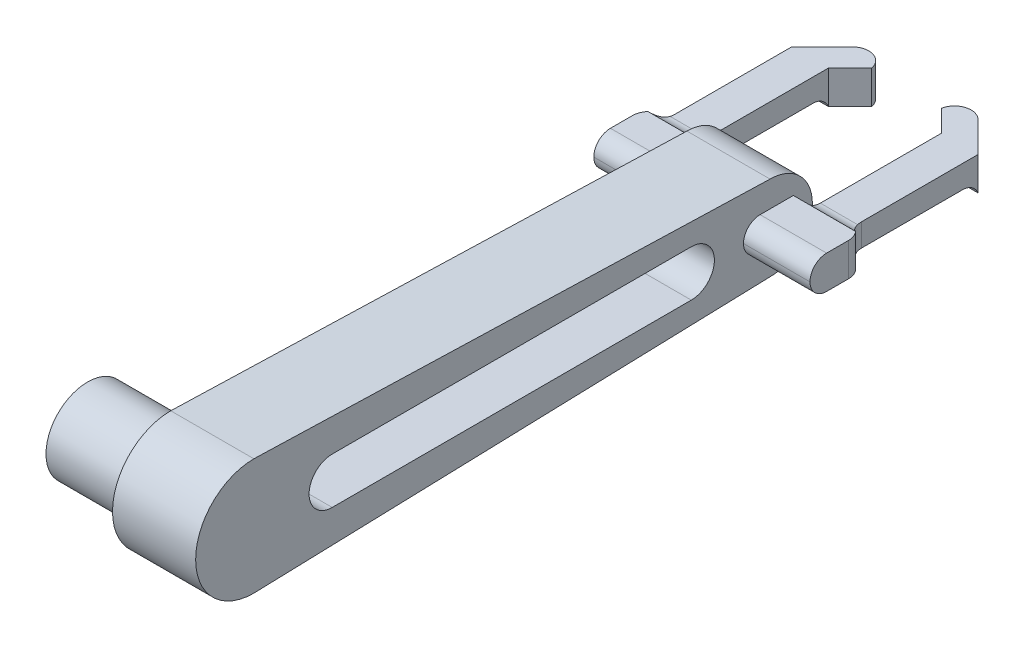
from build123d import *

# Parameters (mm, degrees)
Y_KSEKLIK_EKSTR_ZYON1_DEPTH = 50
IZIM2_R                     = 25
Y_KSEKLIK_EKSTR_ZYON2_DEPTH = 50
IZIM3_W                     = 30
IZIM3_H                     = 20
Y_KSEKLIK_EKSTR_ZYON3_DEPTH = 40
IZIM4_W                     = 22.094425692
IZIM4_H                     = 13.717833442
Y_KSEKLIK_EKSTR_ZYON4_DEPTH = 80
Y_KSEKLIK_EKSTR_ZYON5_DEPTH = 20
RADYUS1_R                   = 10
RADYUS3_R                   = 10
RADYUS4_R                   = 10
RADYUS8_R                   = 10
RADYUS9_R                   = 10
RADYUS1_OF_AYNALAMA2_R      = 10
RADYUS3_OF_AYNALAMA2_R      = 10
RADYUS4_OF_AYNALAMA2_R      = 10
RADYUS8_OF_AYNALAMA2_R      = 10
RADYUS10_R                  = 10
KES_EKSTR_ZYON1_DEPTH       = 60


# Some blends are built 0.0001 mm under size
with BuildPart() as part:
    # Çizim1 → Yükseklik-Ekstrüzyon1 (new body)
    with BuildSketch(Plane(origin=(0, 0, 0), x_dir=(0, 0, -1), z_dir=(1, 0, 0))):
        with BuildLine():
            Line((0, 35), (310.428755788, 25.455915403))
            ThreePointArc((310.428755788, 25.455915403), (335.884671191, 0), (310.428755788, -25.455915403))
            Line((310.428755788, -25.455915403), (0, -35))
            ThreePointArc((0, -35), (-35, 0), (0, 35))
        make_face()
    extrude(amount=Y_KSEKLIK_EKSTR_ZYON1_DEPTH)

    # Çizim2 → Yükseklik-Ekstrüzyon2 (add)
    with BuildSketch(Plane.ZY):
        with Locations(Location((0, 0, 0), (0, 0, 180))):
            Circle(IZIM2_R)
    extrude(amount=Y_KSEKLIK_EKSTR_ZYON2_DEPTH)

    # Çizim3 → Yükseklik-Ekstrüzyon3 (add)
    with BuildSketch(Plane(origin=(50, 0, 0), x_dir=(0, 0, -1), z_dir=(1, 0, 0))):
        with Locations((309.433006003, -0.091766489)):
            Rectangle(IZIM3_W, IZIM3_H)
    y_kseklik_ekstr_zyon3 = extrude(amount=Y_KSEKLIK_EKSTR_ZYON3_DEPTH)

    # Çizim4 → Yükseklik-Ekstrüzyon4 (add)
    with BuildSketch(Plane(origin=(0, 0, -324.433006003), x_dir=(-1, 0, 0), z_dir=(0, 0, -1))):
        with Locations((-70, -0.091766489)):
            Rectangle(IZIM4_W, IZIM4_H)
    y_kseklik_ekstr_zyon4 = extrude(amount=Y_KSEKLIK_EKSTR_ZYON4_DEPTH)

    # Çizim5 → Yükseklik-Ekstrüzyon5 (add)
    with BuildSketch(Plane(origin=(0, 6.767150232, 0), x_dir=(1, 0, 0), z_dir=(0, 1, 0))):
        Polygon((81.047212846, 404.433006003), (45.927609997, 439.552608852), (45.927609997, 417.45818316), (58.952787154, 404.433006003), align=None)
    y_kseklik_ekstr_zyon5 = extrude(amount=-Y_KSEKLIK_EKSTR_ZYON5_DEPTH)

    # Radyus1
    # the kernel refuses this fillet: 10 mm, written as the material it adds along each edge
    with BuildSketch(Plane(origin=(81.047212846, 6.767150232, -324.433006003), x_dir=(0, 1, 0), z_dir=(-1, 0, 0)), Plane(origin=(58.952787154, -6.95068321, -324.433006003), x_dir=(0, -1, 0), z_dir=(1, 0, 0))) as radyus1_piece_1:
        with BuildLine():
            CenterArc((10, 7.277036582), RADYUS1_R, 180, 46.694227485)
            Line((0, 7.277036582), (-0.2, 7.277036582))
            Line((-0.2, 7.277036582), (-0.2, 0))
            Line((-0.2, 0), (0, -0.2))
            ThreePointArc((0, -0.2), (1.570541639, -0.2), (3.003904945, -0.145540732))
            Line((3.003904945, -0.145540732), (3.141083279, 0))
        make_face()
    extrude(amount=22.094425692)
    with BuildSketch(Plane(origin=(81.047212846, -6.95068321, -324.433006003), x_dir=(1, 0, 0), z_dir=(0, 1, 0))) as radyus1_piece_2:
        with BuildLine():
            CenterArc((10, 9.945016101), RADYUS1_R, 180, 83.988891185)
            Line((0, 9.945016101), (-0.2, 9.945016101))
            Line((-0.2, 9.945016101), (-0.2, 0))
            Line((-0.2, 0), (0, -0.2))
            ThreePointArc((0, -0.2), (4.476393577, -0.2), (8.931842897, -0.198900322))
            Line((8.931842897, -0.198900322), (8.952787154, 0))
        make_face()
    extrude(amount=13.717833442)
    with BuildSketch(Plane(origin=(81.047212846, -6.95068321, -324.433006003), x_dir=(1, 0, 0), z_dir=(0, 1, 0))) as radyus1_piece_3a_section:
        with BuildLine():
            CenterArc((10, 9.945016101), RADYUS1_R, 180, 83.988891185)
            Line((0, 9.945016101), (-0.2, 9.945016101))
            Line((-0.2, 9.945016101), (-0.2, 0))
            Line((-0.2, 0), (0, -0.2))
            ThreePointArc((0, -0.2), (4.476393577, -0.2), (8.931842897, -0.198900322))
            Line((8.931842897, -0.198900322), (8.952787154, 0))
        make_face()
    radyus1_piece_3a = extrude(amount=38.580373695, mode=Mode.PRIVATE)
    radyus1_piece_3a = split(radyus1_piece_3a, bisect_by=Plane(origin=(83.202696921, 6.767150232, -326.71552739), z_dir=(0, 1, 0)), keep=Keep.TOP, mode=Mode.PRIVATE)
    with BuildSketch(Plane(origin=(99.2398043, 6.767150232, -324.433006003), x_dir=(0, 1, 0), z_dir=(-1, 0, 0))) as radyus1_piece_3b_section:
        with BuildLine():
            CenterArc((10, 7.277036582), RADYUS1_R, 180, 46.694227485)
            Line((0, 7.277036582), (-0.2, 7.277036582))
            Line((-0.2, 7.277036582), (-0.2, 0))
            Line((-0.2, 0), (0, -0.2))
            ThreePointArc((0, -0.2), (1.570541639, -0.2), (3.003904945, -0.145540732))
            Line((3.003904945, -0.145540732), (3.141083279, 0))
        make_face()
    radyus1_piece_3b = extrude(amount=40.287017146, mode=Mode.PRIVATE)
    radyus1_piece_3b = split(radyus1_piece_3b, bisect_by=Plane(origin=(81.047212846, 7.54925635, -326.367172989), z_dir=(1, 0, 0)), keep=Keep.TOP, mode=Mode.PRIVATE)
    radyus1_piece_3 = radyus1_piece_3a & radyus1_piece_3b
    add(radyus1_piece_3)
    with BuildSketch(Plane(origin=(81.047212846, -31.813223463, -324.433006003), x_dir=(1, 0, 0), z_dir=(0, 1, 0))) as radyus1_piece_4a_section:
        with BuildLine():
            CenterArc((10, 9.945016101), RADYUS1_R, 180, 83.988891185)
            Line((0, 9.945016101), (-0.2, 9.945016101))
            Line((-0.2, 9.945016101), (-0.2, 0))
            Line((-0.2, 0), (0, -0.2))
            ThreePointArc((0, -0.2), (4.476393577, -0.2), (8.931842897, -0.198900322))
            Line((8.931842897, -0.198900322), (8.952787154, 0))
        make_face()
    radyus1_piece_4a = extrude(amount=38.580373695, mode=Mode.PRIVATE)
    radyus1_piece_4a = split(radyus1_piece_4a, bisect_by=Plane(origin=(83.202696921, -6.95068321, -326.71552739), z_dir=(0, -1, 0)), keep=Keep.TOP, mode=Mode.PRIVATE)
    with BuildSketch(Plane(origin=(58.952787154, -6.95068321, -324.433006003), x_dir=(0, -1, 0), z_dir=(1, 0, 0))) as radyus1_piece_4b_section:
        with BuildLine():
            CenterArc((10, 7.277036582), RADYUS1_R, 180, 46.694227485)
            Line((0, 7.277036582), (-0.2, 7.277036582))
            Line((-0.2, 7.277036582), (-0.2, 0))
            Line((-0.2, 0), (0, -0.2))
            ThreePointArc((0, -0.2), (1.570541639, -0.2), (3.003904945, -0.145540732))
            Line((3.003904945, -0.145540732), (3.141083279, 0))
        make_face()
    radyus1_piece_4b = extrude(amount=40.287017146, mode=Mode.PRIVATE)
    radyus1_piece_4b = split(radyus1_piece_4b, bisect_by=Plane(origin=(81.047212846, -7.732789327, -326.367172989), z_dir=(1, 0, 0)), keep=Keep.TOP, mode=Mode.PRIVATE)
    radyus1_piece_4 = radyus1_piece_4a & radyus1_piece_4b
    add(radyus1_piece_4)

    # Radyus3
    radyus3_edges = [part.edges().sort_by_distance(p)[0] for p in [
        (90, -0.091766489, -324.433006003),
    ]]
    fillet(radyus3_edges, radius=RADYUS3_R)

    # Radyus4
    radyus4_edges = [part.edges().sort_by_distance(p)[0] for p in [
        (70, -10.091766489, -294.433006003),
        (70, 9.908233511, -294.433006003),
    ]]
    fillet(radyus4_edges, radius=RADYUS4_R - 0.0001)  # a hair under: the kernel refuses the full size

    # Radyus8
    # the kernel refuses this fillet: 10 mm, written as the material it takes off along each edge
    with BuildSketch(Plane(origin=(45.927609997, 66.498077734, -439.552608852), x_dir=(0, 0, 1), z_dir=(0, -1, 0))) as radyus8_piece_1:
        with BuildLine():
            CenterArc((23.965525365, -9.823389741), RADYUS8_R, 100.784173019, 124.215826981)
            Line((16.894457553, -16.894457553), (16.753036197, -17.03587891))
            Line((16.753036197, -17.03587891), (-0.141421356, -0.141421356))
            Line((-0.141421356, -0.141421356), (0, 0.2))
            ThreePointArc((0, 0.2), (11.047212846, 0.2), (22.057003698, 0.196467795))
            Line((22.057003698, 0.196467795), (22.094425692, 0))
        make_face()
    extrude(amount=139.461855004, mode=Mode.SUBTRACT)

    # Radyus9
    # the kernel refuses this fillet: 10 mm, written as the material it adds along each edge
    with BuildSketch(Plane(origin=(58.952787154, -6.95068321, -404.433006003), x_dir=(0, 0, 1), z_dir=(1, 0, 0))) as radyus9_piece_1_section:
        with BuildLine():
            CenterArc((9.283195274, 10), RADYUS9_R, 201.825642852, 68.174357148)
            Line((0, 6.282166558), (-0.185663905, 6.207809889))
            ThreePointArc((-0.185663905, 6.207809889), (-0.2, 3.141083279), (-0.2, 0))
            Line((-0.2, 0), (0, -0.2))
            Line((0, -0.2), (9.283195274, -0.2))
            Line((9.283195274, -0.2), (9.283195274, 0))
        make_face()
    radyus9_piece_1 = extrude(amount=22.094425692, mode=Mode.PRIVATE)
    radyus9_piece_1 = split(radyus9_piece_1, bisect_by=Plane(origin=(62.026503816, -7.778070803, -401.359289341), z_dir=(-0.707106781186545, 0, 0.70710678118655)), keep=Keep.TOP, mode=Mode.PRIVATE)
    add(radyus9_piece_1)
    with BuildSketch(Plane(origin=(35.744798969, -6.95068321, -404.433006003), x_dir=(0, 0, 1), z_dir=(1, 0, 0))) as radyus9_piece_2_section:
        with BuildLine():
            CenterArc((9.283195274, 10), RADYUS9_R, 201.825642852, 68.174357148)
            Line((0, 6.282166558), (-0.185663905, 6.207809889))
            ThreePointArc((-0.185663905, 6.207809889), (-0.2, 3.141083279), (-0.2, 0))
            Line((-0.2, 0), (0, -0.2))
            Line((0, -0.2), (9.283195274, -0.2))
            Line((9.283195274, -0.2), (9.283195274, 0))
        make_face()
    radyus9_piece_2 = extrude(amount=45.302413877, mode=Mode.PRIVATE)
    radyus9_piece_2 = split(radyus9_piece_2, bisect_by=Plane(origin=(58.952787154, -9.958064826, -404.564448842), z_dir=(-1, 0, 0)), keep=Keep.TOP, mode=Mode.PRIVATE)
    radyus9_piece_2 = split(radyus9_piece_2, bisect_by=Plane(origin=(58.854205025, -9.958064826, -404.531588132), z_dir=(0.707106781186545, 0, -0.70710678118655)), keep=Keep.TOP, mode=Mode.PRIVATE)
    add(radyus9_piece_2)
    with BuildSketch(Plane(origin=(58.952787154, -6.95068321, -404.433006003), x_dir=(0, 0, 1), z_dir=(1, 0, 0))) as radyus9_piece_3_section:
        with BuildLine():
            CenterArc((9.283195274, 10), RADYUS9_R, 201.825642852, 68.174357148)
            Line((0, 6.282166558), (-0.185663905, 6.207809889))
            ThreePointArc((-0.185663905, 6.207809889), (-0.2, 3.141083279), (-0.2, 0))
            Line((-0.2, 0), (0, -0.2))
            Line((0, -0.2), (9.283195274, -0.2))
            Line((9.283195274, -0.2), (9.283195274, 0))
        make_face()
    radyus9_piece_3 = extrude(amount=22.094425692, mode=Mode.PRIVATE)
    radyus9_piece_3 = split(radyus9_piece_3, bisect_by=Plane(origin=(66.003516805, -8.660917464, -397.382276353), z_dir=(0.707106781186545, 0, -0.70710678118655)), keep=Keep.TOP, mode=Mode.PRIVATE)
    radyus9_piece_3 = split(radyus9_piece_3, bisect_by=Plane(origin=(77.050729651, -8.660917464, -408.429489198), z_dir=(-0.7071067811865436, 0, 0.7071067811865515)), keep=Keep.TOP, mode=Mode.PRIVATE)
    add(radyus9_piece_3)

    # Aynalama2: Yükseklik-Ekstrüzyon3, Yükseklik-Ekstrüzyon4, Yükseklik-Ekstrüzyon5 across plane
    add(y_kseklik_ekstr_zyon3.mirror(Plane(origin=(25, 0, 0), x_dir=(0, 0, 1), z_dir=(1, 0, 0))))
    add(y_kseklik_ekstr_zyon4.mirror(Plane(origin=(25, 0, 0), x_dir=(0, 0, 1), z_dir=(1, 0, 0))))
    add(y_kseklik_ekstr_zyon5.mirror(Plane(origin=(25, 0, 0), x_dir=(0, 0, 1), z_dir=(1, 0, 0))))

    # Radyus1 of Aynalama2
    # the kernel refuses this fillet: 10 mm, written as the material it adds along each edge
    with BuildSketch(Plane(origin=(-31.047212846, 6.767150232, -324.433006003), x_dir=(0, 1, 0), z_dir=(1, 0, 0)), Plane(origin=(-8.952787154, -6.95068321, -324.433006003), x_dir=(0, -1, 0), z_dir=(-1, 0, 0))) as radyus1_of_aynalama2_piece_1:
        with BuildLine():
            CenterArc((10, -7.277036582), RADYUS1_OF_AYNALAMA2_R, 133.305772515, 46.694227485)
            Line((0, -7.277036582), (-0.2, -7.277036582))
            Line((-0.2, -7.277036582), (-0.2, 0))
            Line((-0.2, 0), (0, 0.2))
            ThreePointArc((0, 0.2), (1.570541639, 0.2), (3.003904945, 0.145540732))
            Line((3.003904945, 0.145540732), (3.141083279, 0))
        make_face()
    extrude(amount=22.094425692)
    with BuildSketch(Plane(origin=(-31.047212846, -6.95068321, -324.433006003), x_dir=(-1, 0, 0), z_dir=(0, 1, 0))) as radyus1_of_aynalama2_piece_2:
        with BuildLine():
            CenterArc((10, -9.945016101), RADYUS1_OF_AYNALAMA2_R, 96.011108815, 83.988891185)
            Line((0, -9.945016101), (-0.2, -9.945016101))
            Line((-0.2, -9.945016101), (-0.2, 0))
            Line((-0.2, 0), (0, 0.2))
            ThreePointArc((0, 0.2), (4.476393577, 0.2), (8.931842897, 0.198900322))
            Line((8.931842897, 0.198900322), (8.952787154, 0))
        make_face()
    extrude(amount=13.717833442)
    with BuildSketch(Plane(origin=(-31.047212846, -6.95068321, -324.433006003), x_dir=(-1, 0, 0), z_dir=(0, 1, 0))) as radyus1_of_aynalama2_piece_3a_section:
        with BuildLine():
            CenterArc((10, -9.945016101), RADYUS1_OF_AYNALAMA2_R, 96.011108815, 83.988891185)
            Line((0, -9.945016101), (-0.2, -9.945016101))
            Line((-0.2, -9.945016101), (-0.2, 0))
            Line((-0.2, 0), (0, 0.2))
            ThreePointArc((0, 0.2), (4.476393577, 0.2), (8.931842897, 0.198900322))
            Line((8.931842897, 0.198900322), (8.952787154, 0))
        make_face()
    radyus1_of_aynalama2_piece_3a = extrude(amount=38.580373695, mode=Mode.PRIVATE)
    radyus1_of_aynalama2_piece_3a = split(radyus1_of_aynalama2_piece_3a, bisect_by=Plane(origin=(-33.202696921, 6.767150232, -326.71552739), z_dir=(0, 1, 0)), keep=Keep.TOP, mode=Mode.PRIVATE)
    with BuildSketch(Plane(origin=(-49.2398043, 6.767150232, -324.433006003), x_dir=(0, 1, 0), z_dir=(1, 0, 0))) as radyus1_of_aynalama2_piece_3b_section:
        with BuildLine():
            CenterArc((10, -7.277036582), RADYUS1_OF_AYNALAMA2_R, 133.305772515, 46.694227485)
            Line((0, -7.277036582), (-0.2, -7.277036582))
            Line((-0.2, -7.277036582), (-0.2, 0))
            Line((-0.2, 0), (0, 0.2))
            ThreePointArc((0, 0.2), (1.570541639, 0.2), (3.003904945, 0.145540732))
            Line((3.003904945, 0.145540732), (3.141083279, 0))
        make_face()
    radyus1_of_aynalama2_piece_3b = extrude(amount=40.287017146, mode=Mode.PRIVATE)
    radyus1_of_aynalama2_piece_3b = split(radyus1_of_aynalama2_piece_3b, bisect_by=Plane(origin=(-31.047212846, 7.54925635, -326.367172989), z_dir=(-1, 0, 0)), keep=Keep.TOP, mode=Mode.PRIVATE)
    radyus1_of_aynalama2_piece_3 = radyus1_of_aynalama2_piece_3a & radyus1_of_aynalama2_piece_3b
    add(radyus1_of_aynalama2_piece_3)
    with BuildSketch(Plane(origin=(-31.047212846, -31.813223463, -324.433006003), x_dir=(-1, 0, 0), z_dir=(0, 1, 0))) as radyus1_of_aynalama2_piece_4a_section:
        with BuildLine():
            CenterArc((10, -9.945016101), RADYUS1_OF_AYNALAMA2_R, 96.011108815, 83.988891185)
            Line((0, -9.945016101), (-0.2, -9.945016101))
            Line((-0.2, -9.945016101), (-0.2, 0))
            Line((-0.2, 0), (0, 0.2))
            ThreePointArc((0, 0.2), (4.476393577, 0.2), (8.931842897, 0.198900322))
            Line((8.931842897, 0.198900322), (8.952787154, 0))
        make_face()
    radyus1_of_aynalama2_piece_4a = extrude(amount=38.580373695, mode=Mode.PRIVATE)
    radyus1_of_aynalama2_piece_4a = split(radyus1_of_aynalama2_piece_4a, bisect_by=Plane(origin=(-33.202696921, -6.95068321, -326.71552739), z_dir=(0, -1, 0)), keep=Keep.TOP, mode=Mode.PRIVATE)
    with BuildSketch(Plane(origin=(-8.952787154, -6.95068321, -324.433006003), x_dir=(0, -1, 0), z_dir=(-1, 0, 0))) as radyus1_of_aynalama2_piece_4b_section:
        with BuildLine():
            CenterArc((10, -7.277036582), RADYUS1_OF_AYNALAMA2_R, 133.305772515, 46.694227485)
            Line((0, -7.277036582), (-0.2, -7.277036582))
            Line((-0.2, -7.277036582), (-0.2, 0))
            Line((-0.2, 0), (0, 0.2))
            ThreePointArc((0, 0.2), (1.570541639, 0.2), (3.003904945, 0.145540732))
            Line((3.003904945, 0.145540732), (3.141083279, 0))
        make_face()
    radyus1_of_aynalama2_piece_4b = extrude(amount=40.287017146, mode=Mode.PRIVATE)
    radyus1_of_aynalama2_piece_4b = split(radyus1_of_aynalama2_piece_4b, bisect_by=Plane(origin=(-31.047212846, -7.732789327, -326.367172989), z_dir=(-1, 0, 0)), keep=Keep.TOP, mode=Mode.PRIVATE)
    radyus1_of_aynalama2_piece_4 = radyus1_of_aynalama2_piece_4a & radyus1_of_aynalama2_piece_4b
    add(radyus1_of_aynalama2_piece_4)

    # Radyus3 of Aynalama2
    radyus3_of_aynalama2_edges = [part.edges().sort_by_distance(p)[0] for p in [
        (-40, -0.091766489, -324.433006003),
    ]]
    fillet(radyus3_of_aynalama2_edges, radius=RADYUS3_OF_AYNALAMA2_R)

    # Radyus4 of Aynalama2
    radyus4_of_aynalama2_edges = [part.edges().sort_by_distance(p)[0] for p in [
        (-20, -10.091766489, -294.433006003),
        (-20, 9.908233511, -294.433006003),
    ]]
    fillet(radyus4_of_aynalama2_edges, radius=RADYUS4_OF_AYNALAMA2_R - 0.0001)  # a hair under: the kernel refuses the full size

    # Radyus8 of Aynalama2
    # the kernel refuses this fillet: 10 mm, written as the material it takes off along each edge
    with BuildSketch(Plane(origin=(4.072390003, 66.498077734, -439.552608852), x_dir=(-0.7071067811865518, 0, 0.7071067811865432), z_dir=(0, -1, 0))) as radyus8_of_aynalama2_piece_1:
        with BuildLine():
            CenterArc((23.892371001, -10), RADYUS8_OF_AYNALAMA2_R, 90, 124.215826981)
            Line((15.623118233, -15.623118233), (15.457733178, -15.735580598))
            ThreePointArc((15.457733178, -15.735580598), (7.67013776, -7.952980473), (-0.141421356, -0.141421356))
            Line((-0.141421356, -0.141421356), (0, 0.2))
            Line((0, 0.2), (23.892371001, 0.2))
            Line((23.892371001, 0.2), (23.892371001, 0))
        make_face()
    extrude(amount=139.461855004, mode=Mode.SUBTRACT)

    # Radyus10
    # the kernel refuses this fillet: 10 mm, written as the material it adds along each edge
    with BuildSketch(Plane(origin=(-8.952787154, -6.95068321, -404.433006003), x_dir=(0, 0, 1), z_dir=(-1, 0, 0))) as radyus10_piece_1_section:
        with BuildLine():
            CenterArc((9.283195274, -10), RADYUS10_R, 90, 68.174357148)
            Line((0, -6.282166558), (-0.185663905, -6.207809889))
            ThreePointArc((-0.185663905, -6.207809889), (-0.2, -3.141083279), (-0.2, 0))
            Line((-0.2, 0), (0, 0.2))
            Line((0, 0.2), (9.283195274, 0.2))
            Line((9.283195274, 0.2), (9.283195274, 0))
        make_face()
    radyus10_piece_1 = extrude(amount=22.094425692, mode=Mode.PRIVATE)
    radyus10_piece_1 = split(radyus10_piece_1, bisect_by=Plane(origin=(-12.026503816, -7.778070803, -401.359289341), z_dir=(0.707106781186545, 0, 0.70710678118655)), keep=Keep.TOP, mode=Mode.PRIVATE)
    add(radyus10_piece_1)
    with BuildSketch(Plane(origin=(14.255201031, -6.95068321, -404.433006003), x_dir=(0, 0, 1), z_dir=(-1, 0, 0))) as radyus10_piece_2_section:
        with BuildLine():
            CenterArc((9.283195274, -10), RADYUS10_R, 90, 68.174357148)
            Line((0, -6.282166558), (-0.185663905, -6.207809889))
            ThreePointArc((-0.185663905, -6.207809889), (-0.2, -3.141083279), (-0.2, 0))
            Line((-0.2, 0), (0, 0.2))
            Line((0, 0.2), (9.283195274, 0.2))
            Line((9.283195274, 0.2), (9.283195274, 0))
        make_face()
    radyus10_piece_2 = extrude(amount=45.302413877, mode=Mode.PRIVATE)
    radyus10_piece_2 = split(radyus10_piece_2, bisect_by=Plane(origin=(-8.952787154, -9.958064826, -404.564448842), z_dir=(1, 0, 0)), keep=Keep.TOP, mode=Mode.PRIVATE)
    radyus10_piece_2 = split(radyus10_piece_2, bisect_by=Plane(origin=(-8.854205025, -9.958064826, -404.531588132), z_dir=(-0.707106781186545, 0, -0.70710678118655)), keep=Keep.TOP, mode=Mode.PRIVATE)
    add(radyus10_piece_2)
    with BuildSketch(Plane(origin=(-8.952787154, -6.95068321, -404.433006003), x_dir=(0, 0, 1), z_dir=(-1, 0, 0))) as radyus10_piece_3_section:
        with BuildLine():
            CenterArc((9.283195274, -10), RADYUS10_R, 90, 68.174357148)
            Line((0, -6.282166558), (-0.185663905, -6.207809889))
            ThreePointArc((-0.185663905, -6.207809889), (-0.2, -3.141083279), (-0.2, 0))
            Line((-0.2, 0), (0, 0.2))
            Line((0, 0.2), (9.283195274, 0.2))
            Line((9.283195274, 0.2), (9.283195274, 0))
        make_face()
    radyus10_piece_3 = extrude(amount=22.094425692, mode=Mode.PRIVATE)
    radyus10_piece_3 = split(radyus10_piece_3, bisect_by=Plane(origin=(-16.003516805, -8.660917464, -397.382276353), z_dir=(-0.707106781186545, 0, -0.70710678118655)), keep=Keep.TOP, mode=Mode.PRIVATE)
    radyus10_piece_3 = split(radyus10_piece_3, bisect_by=Plane(origin=(-27.050729651, -8.660917464, -408.429489198), z_dir=(0.7071067811865436, 0, 0.7071067811865515)), keep=Keep.TOP, mode=Mode.PRIVATE)
    add(radyus10_piece_3)

    # Çizim6 → Kes-Ekstrüzyon1 (cut)
    with BuildSketch(Plane(origin=(50, 0, 0), x_dir=(0, 0, -1), z_dir=(1, 0, 0))):
        with BuildLine():
            Line((47.109572829, 13.894766115), (263.058999376, 13.894766115))
            ThreePointArc((263.058999376, 13.894766115), (276.953765491, 0), (263.058999376, -13.894766115))
            Line((263.058999376, -13.894766115), (47.109572829, -13.894766115))
            ThreePointArc((47.109572829, -13.894766115), (33.214806714, 0), (47.109572829, 13.894766115))
        make_face()
    extrude(amount=-KES_EKSTR_ZYON1_DEPTH, mode=Mode.SUBTRACT)


solid = part.part
